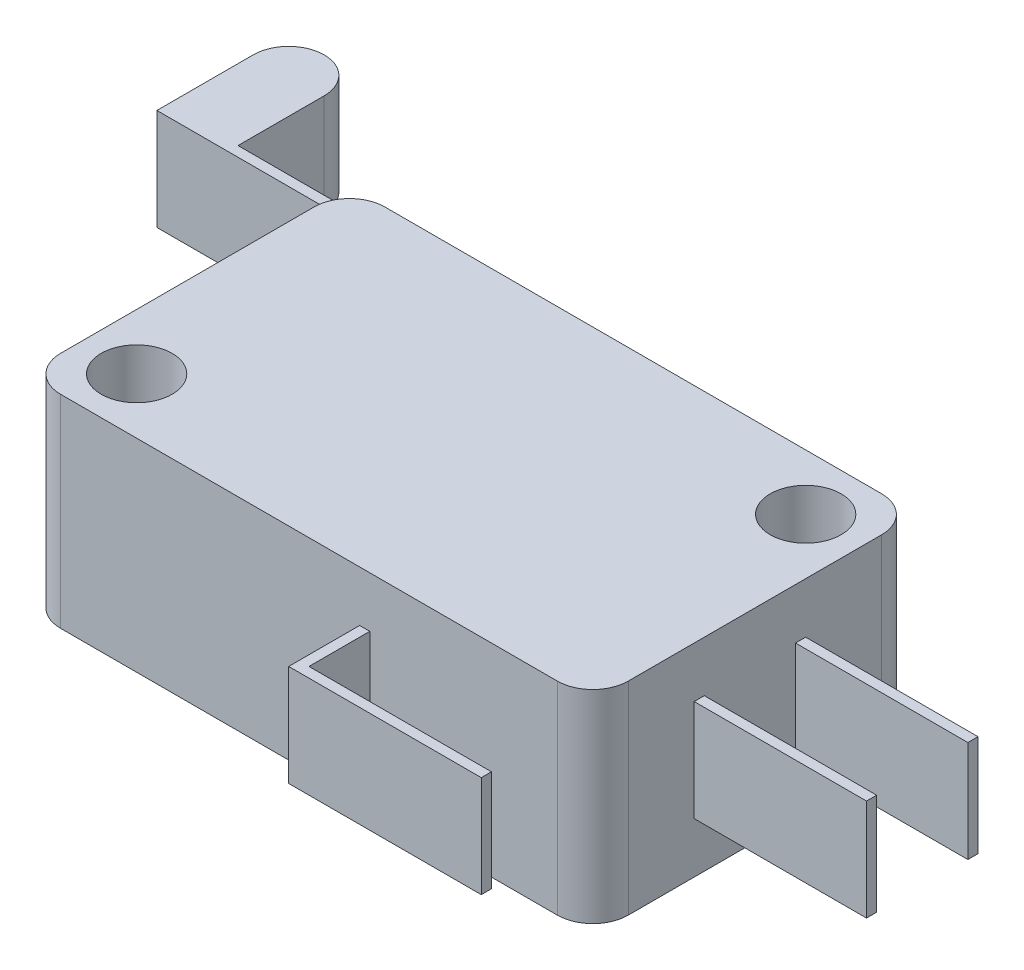
from build123d import *

# Parameters (mm, degrees)
SKETCH1_W           = 28
SKETCH1_H           = 16
BOSS_EXTRUDE1_DEPTH = 10
BOSS_EXTRUDE2_DEPTH = 1.5
SKETCH4_W           = 0.5
SKETCH4_H           = 5
BOSS_EXTRUDE3_DEPTH = 27
SKETCH6_W           = 3.5
SKETCH6_H           = 6
BOSS_EXTRUDE4_DEPTH = 5
FILLET1_R           = 1.75
BOSS_EXTRUDE5_DEPTH = 3.5
SKETCH8_W           = 0.5
SKETCH8_H           = 5
BOSS_EXTRUDE6_DEPTH = 9
BOSS_EXTRUDE7_DEPTH = 8.5
CUT_EXTRUDE1_DEPTH  = 45.547727215
CUT_EXTRUDE2_DEPTH  = 45.547727215
FILLET2_R           = 1.75


with BuildPart() as part:
    # Sketch1 → Boss-Extrude1 (new body)
    with BuildSketch(Plane(origin=(0, 0, 0), x_dir=(1, 0, 0), z_dir=(0, 1, 0))):
        with Locations((14, 8)):
            Rectangle(SKETCH1_W, SKETCH1_H)
    extrude(amount=BOSS_EXTRUDE1_DEPTH)

    # Sketch3 → Boss-Extrude2 (add)
    with BuildSketch(Plane(origin=(0, 0, -16), x_dir=(-1, 0, 0), z_dir=(0, 0, -1))):
        Polygon((-17, 2.5), (-17, 5), (-17, 7.5), (-16.5, 7.5), (-16.5, 2.5), align=None)
    extrude(amount=BOSS_EXTRUDE2_DEPTH)

    # Sketch4 → Boss-Extrude3 (add)
    with BuildSketch(Plane.ZY.offset(-16.5)):
        with Locations((-17.25, 5)):
            Rectangle(SKETCH4_W, SKETCH4_H)
    extrude(amount=BOSS_EXTRUDE3_DEPTH)

    # Sketch6 → Boss-Extrude4 (add)
    with BuildSketch(Plane.XZ.offset(-2.5)):
        with Locations((-8.75, -20.5)):
            Rectangle(SKETCH6_W, SKETCH6_H)
    extrude(amount=-BOSS_EXTRUDE4_DEPTH)

    # Fillet1
    fillet1_edges = [part.edges().sort_by_distance(p)[0] for p in [
        (-7, 5, -23.5),
        (-10.5, 5, -23.5),
    ]]
    fillet(fillet1_edges, radius=FILLET1_R - 0.0001)  # a hair under: the kernel refuses the full size

    # Sketch7 → Boss-Extrude5 (add)
    with BuildSketch(Plane.XY):
        Polygon((16.5, 2.5), (17, 2.5), (17, 5), (17, 7.5), (16.5, 7.5), align=None)
    extrude(amount=BOSS_EXTRUDE5_DEPTH)

    # Sketch8 → Boss-Extrude6 (add)
    with BuildSketch(Plane(origin=(17, 0, 0), x_dir=(0, 0, -1), z_dir=(1, 0, 0))):
        with Locations((-3.25, 5)):
            Rectangle(SKETCH8_W, SKETCH8_H)
    extrude(amount=BOSS_EXTRUDE6_DEPTH)

    # Sketch9 → Boss-Extrude7 (add)
    with BuildSketch(Plane(origin=(28, 0, 0), x_dir=(0, 0, -1), z_dir=(1, 0, 0))):
        Polygon((10, 2.5), (10.5, 2.5), (10.5, 5), (10.5, 7.5), (10, 7.5), align=None)
        Polygon((5, 5), (5, 7.5), (5.5, 7.5), (5.5, 2.5), (5, 2.5), align=None)
    extrude(amount=BOSS_EXTRUDE7_DEPTH)

    # Sketch10 → Cut-Extrude1 (cut, through all)
    with BuildSketch(Plane(origin=(0, 10, 0), x_dir=(1, 0, 0), z_dir=(0, 1, 0))):
        with BuildLine():
            ThreePointArc((25.25, 15), (24.012563133, 12.012563133), (27, 13.25))
            Line((27, 13.25), (25.25, 13.25))
            Line((25.25, 13.25), (25.25, 15))
        make_face()
        with BuildLine():
            Line((25.25, 13.25), (27, 13.25))
            ThreePointArc((27, 13.25), (26.487436867, 14.487436867), (25.25, 15))
            Line((25.25, 15), (25.25, 13.25))
        make_face()
    extrude(amount=-CUT_EXTRUDE1_DEPTH, mode=Mode.SUBTRACT)

    # Sketch11 → Cut-Extrude2 (cut, through all)
    with BuildSketch(Plane(origin=(0, 10, 0), x_dir=(1, 0, 0), z_dir=(0, 1, 0))):
        with BuildLine():
            ThreePointArc((4.5, 2.75), (2.75, 4.5), (1, 2.75))
            Line((1, 2.75), (2.75, 2.75))
            Line((2.75, 2.75), (2.75, 1))
            ThreePointArc((2.75, 1), (3.987436867, 1.512563133), (4.5, 2.75))
        make_face()
        with BuildLine():
            Line((2.75, 2.75), (1, 2.75))
            ThreePointArc((1, 2.75), (1.512563133, 1.512563133), (2.75, 1))
            Line((2.75, 1), (2.75, 2.75))
        make_face()
    extrude(amount=-CUT_EXTRUDE2_DEPTH, mode=Mode.SUBTRACT)

    # Fillet2
    fillet2_edges = [part.edges().sort_by_distance(p)[0] for p in [
        (0, 5, -16),
        (28, 5, -16),
        (28, 5, 0),
        (0, 5, 0),
    ]]
    fillet(fillet2_edges, radius=FILLET2_R)


solid = part.part
